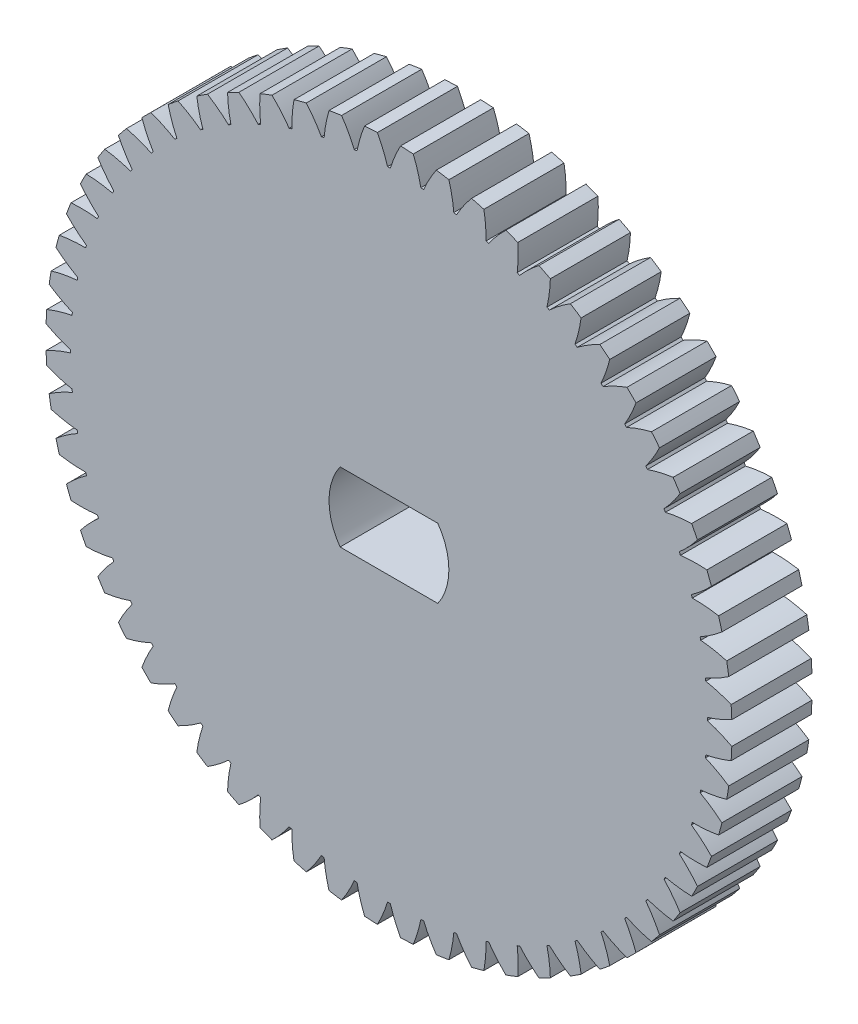
from build123d import *

# Parameters (mm, degrees)
BOSS_EXTRUDE1_DEPTH = 3.175


with BuildPart() as part:
    # Sketch2 → Boss-Extrude1 (new body)
    with BuildSketch(Plane.XY):
        with BuildLine():
            ThreePointArc((9.415507018, 8.403216731), (9.37852962, 8.444465999), (9.34137151, 8.485552554))
            ThreePointArc((9.34137151, 8.485552554), (9.588912282, 8.948159752), (9.790125097, 9.432716514))
            ThreePointArc((9.790125097, 9.432716514), (9.613081978, 9.613081978), (9.432716514, 9.790125097))
            ThreePointArc((9.432716514, 9.790125097), (8.948159752, 9.588912282), (8.485552554, 9.34137151))
            ThreePointArc((8.485552554, 9.34137151), (8.444465999, 9.37852962), (8.403216731, 9.415507018))
            ThreePointArc((8.403216731, 9.415507018), (8.601045829, 9.901455062), (8.750506405, 10.404389838))
            ThreePointArc((8.750506405, 10.404389838), (8.555579823, 10.565261196), (8.357696375, 10.722481129))
            ThreePointArc((8.357696375, 10.722481129), (7.896826531, 10.471720605), (7.4626286, 10.177180268))
            ThreePointArc((7.4626286, 10.177180268), (7.417883042, 10.209840107), (7.372994551, 10.242303217))
            ThreePointArc((7.372994551, 10.242303217), (7.518944518, 10.746267958), (7.615015335, 11.262070489))
            ThreePointArc((7.615015335, 11.262070489), (7.404340945, 11.401685201), (7.191107565, 11.537359414))
            ThreePointArc((7.191107565, 11.537359414), (6.758974027, 11.239798566), (6.357942526, 10.901485709))
            ThreePointArc((6.357942526, 10.901485709), (6.310028206, 10.92928945), (6.2619923, 10.956882598))
            ThreePointArc((6.2619923, 10.956882598), (6.354464078, 11.473342493), (6.396092562, 11.996361539))
            ThreePointArc((6.396092562, 11.996361539), (6.171978558, 12.113189957), (5.945731475, 12.225831975))
            ThreePointArc((5.945731475, 12.225831975), (5.547068788, 11.884730941), (5.183597503, 11.506352192))
            ThreePointArc((5.183597503, 11.506352192), (5.13303938, 11.52899521), (5.082382351, 11.551416081))
            ThreePointArc((5.082382351, 11.551416081), (5.120362799, 12.074712688), (5.107092862, 12.599217942))
            ThreePointArc((5.107092862, 12.599217942), (4.871994682, 12.691980069), (4.635212708, 12.780355762))
            ThreePointArc((4.635212708, 12.780355762), (4.274388703, 12.399451718), (3.952459901, 11.985152672))
            ThreePointArc((3.952459901, 11.985152672), (3.899811901, 12.002386886), (3.847088757, 12.019389832))
            ThreePointArc((3.847088757, 12.019389832), (3.830161755, 12.543789803), (3.762138783, 13.064034676))
            ThreePointArc((3.762138783, 13.064034676), (3.518632213, 13.131714191), (3.27390958, 13.194855297))
            ThreePointArc((3.27390958, 13.194855297), (2.954877521, 12.778321506), (2.678018322, 12.332641311))
            ThreePointArc((2.678018322, 12.332641311), (2.623857267, 12.3442779), (2.569645654, 12.355676633))
            ThreePointArc((2.569645654, 12.355676633), (2.497996656, 12.875434532), (2.375965924, 13.385719113))
            ThreePointArc((2.375965924, 13.385719113), (2.126718873, 13.427574505), (1.876736813, 13.464789236))
            ThreePointArc((1.876736813, 13.464789236), (1.602992083, 13.017189331), (1.374235813, 12.545010951))
            ThreePointArc((1.374235813, 12.545010951), (1.319155103, 12.550922422), (1.264048975, 12.556592055))
            ThreePointArc((1.264048975, 12.556592055), (1.138462984, 13.066013306), (0.963761486, 13.56074681))
            ThreePointArc((0.963761486, 13.56074681), (0.711504756, 13.576319502), (0.459002126, 13.587200127))
            ThreePointArc((0.459002126, 13.587200127), (0.233543928, 13.113438104), (0.055396889, 12.619934826))
            ThreePointArc((0.055396889, 12.619934826), (0, 12.620056412), (-0.055396889, 12.619934826))
            ThreePointArc((-0.055396889, 12.619934826), (-0.233543928, 13.113438104), (-0.459002126, 13.587200127))
            ThreePointArc((-0.459002126, 13.587200127), (-0.711504756, 13.576319502), (-0.963761486, 13.56074681))
            ThreePointArc((-0.963761486, 13.56074681), (-1.138462984, 13.066013306), (-1.264048975, 12.556592055))
            ThreePointArc((-1.264048975, 12.556592055), (-1.319155103, 12.550922422), (-1.374235813, 12.545010951))
            ThreePointArc((-1.374235813, 12.545010951), (-1.602992083, 13.017189331), (-1.876736813, 13.464789236))
            ThreePointArc((-1.876736813, 13.464789236), (-2.126718873, 13.427574505), (-2.375965924, 13.385719113))
            ThreePointArc((-2.375965924, 13.385719113), (-2.497996656, 12.875434532), (-2.569645654, 12.355676633))
            ThreePointArc((-2.569645654, 12.355676633), (-2.623857267, 12.3442779), (-2.678018322, 12.332641311))
            ThreePointArc((-2.678018322, 12.332641311), (-2.954877521, 12.778321506), (-3.27390958, 13.194855297))
            ThreePointArc((-3.27390958, 13.194855297), (-3.518632213, 13.131714191), (-3.762138783, 13.064034676))
            ThreePointArc((-3.762138783, 13.064034676), (-3.830161755, 12.543789803), (-3.847088757, 12.019389832))
            ThreePointArc((-3.847088757, 12.019389832), (-3.899811901, 12.002386886), (-3.952459901, 11.985152672))
            ThreePointArc((-3.952459901, 11.985152672), (-4.274388703, 12.399451718), (-4.635212708, 12.780355762))
            ThreePointArc((-4.635212708, 12.780355762), (-4.871994682, 12.691980069), (-5.107092862, 12.599217942))
            ThreePointArc((-5.107092862, 12.599217942), (-5.120362799, 12.074712688), (-5.082382351, 11.551416081))
            ThreePointArc((-5.082382351, 11.551416081), (-5.13303938, 11.52899521), (-5.183597503, 11.506352192))
            ThreePointArc((-5.183597503, 11.506352192), (-5.547068788, 11.884730941), (-5.945731475, 12.225831975))
            ThreePointArc((-5.945731475, 12.225831975), (-6.171978558, 12.113189957), (-6.396092562, 11.996361539))
            ThreePointArc((-6.396092562, 11.996361539), (-6.354464078, 11.473342493), (-6.2619923, 10.956882598))
            ThreePointArc((-6.2619923, 10.956882598), (-6.310028206, 10.92928945), (-6.357942526, 10.901485709))
            ThreePointArc((-6.357942526, 10.901485709), (-6.758974027, 11.239798566), (-7.191107565, 11.537359414))
            ThreePointArc((-7.191107565, 11.537359414), (-7.404340945, 11.401685201), (-7.615015335, 11.262070489))
            ThreePointArc((-7.615015335, 11.262070489), (-7.518944518, 10.746267958), (-7.372994551, 10.242303217))
            ThreePointArc((-7.372994551, 10.242303217), (-7.417883042, 10.209840107), (-7.4626286, 10.177180268))
            ThreePointArc((-7.4626286, 10.177180268), (-7.896826531, 10.471720605), (-8.357696375, 10.722481129))
            ThreePointArc((-8.357696375, 10.722481129), (-8.555579823, 10.565261196), (-8.750506405, 10.404389838))
            ThreePointArc((-8.750506405, 10.404389838), (-8.601045829, 9.901455062), (-8.403216731, 9.415507018))
            ThreePointArc((-8.403216731, 9.415507018), (-8.444465999, 9.37852962), (-8.485552554, 9.34137151))
            ThreePointArc((-8.485552554, 9.34137151), (-8.948159752, 9.588912282), (-9.432716514, 9.790125097))
            ThreePointArc((-9.432716514, 9.790125097), (-9.613081978, 9.613081978), (-9.790125097, 9.432716514))
            ThreePointArc((-9.790125097, 9.432716514), (-9.588912282, 8.948159752), (-9.34137151, 8.485552554))
            ThreePointArc((-9.34137151, 8.485552554), (-9.37852962, 8.444465999), (-9.415507018, 8.403216731))
            ThreePointArc((-9.415507018, 8.403216731), (-9.901455062, 8.601045829), (-10.404389838, 8.750506405))
            ThreePointArc((-10.404389838, 8.750506405), (-10.565261196, 8.555579823), (-10.722481129, 8.357696375))
            ThreePointArc((-10.722481129, 8.357696375), (-10.471720605, 7.896826531), (-10.177180268, 7.4626286))
            ThreePointArc((-10.177180268, 7.4626286), (-10.209840107, 7.417883042), (-10.242303217, 7.372994551))
            ThreePointArc((-10.242303217, 7.372994551), (-10.746267958, 7.518944518), (-11.262070489, 7.615015335))
            ThreePointArc((-11.262070489, 7.615015335), (-11.401685201, 7.404340945), (-11.537359414, 7.191107565))
            ThreePointArc((-11.537359414, 7.191107565), (-11.239798566, 6.758974027), (-10.901485709, 6.357942526))
            ThreePointArc((-10.901485709, 6.357942526), (-10.92928945, 6.310028206), (-10.956882598, 6.2619923))
            ThreePointArc((-10.956882598, 6.2619923), (-11.473342493, 6.354464078), (-11.996361539, 6.396092562))
            ThreePointArc((-11.996361539, 6.396092562), (-12.113189957, 6.171978558), (-12.225831975, 5.945731475))
            ThreePointArc((-12.225831975, 5.945731475), (-11.884730941, 5.547068788), (-11.506352192, 5.183597503))
            ThreePointArc((-11.506352192, 5.183597503), (-11.52899521, 5.13303938), (-11.551416081, 5.082382351))
            ThreePointArc((-11.551416081, 5.082382351), (-12.074712688, 5.120362799), (-12.599217942, 5.107092862))
            ThreePointArc((-12.599217942, 5.107092862), (-12.691980069, 4.871994682), (-12.780355762, 4.635212708))
            ThreePointArc((-12.780355762, 4.635212708), (-12.399451718, 4.274388703), (-11.985152672, 3.952459901))
            ThreePointArc((-11.985152672, 3.952459901), (-12.002386886, 3.899811901), (-12.019389832, 3.847088757))
            ThreePointArc((-12.019389832, 3.847088757), (-12.543789803, 3.830161755), (-13.064034676, 3.762138783))
            ThreePointArc((-13.064034676, 3.762138783), (-13.131714191, 3.518632213), (-13.194855297, 3.27390958))
            ThreePointArc((-13.194855297, 3.27390958), (-12.778321506, 2.954877521), (-12.332641311, 2.678018322))
            ThreePointArc((-12.332641311, 2.678018322), (-12.3442779, 2.623857267), (-12.355676633, 2.569645654))
            ThreePointArc((-12.355676633, 2.569645654), (-12.875434532, 2.497996656), (-13.385719113, 2.375965924))
            ThreePointArc((-13.385719113, 2.375965924), (-13.427574505, 2.126718873), (-13.464789236, 1.876736813))
            ThreePointArc((-13.464789236, 1.876736813), (-13.017189331, 1.602992083), (-12.545010951, 1.374235813))
            ThreePointArc((-12.545010951, 1.374235813), (-12.550922422, 1.319155103), (-12.556592055, 1.264048975))
            ThreePointArc((-12.556592055, 1.264048975), (-13.066013306, 1.138462984), (-13.56074681, 0.963761486))
            ThreePointArc((-13.56074681, 0.963761486), (-13.576319502, 0.711504756), (-13.587200127, 0.459002126))
            ThreePointArc((-13.587200127, 0.459002126), (-13.113438104, 0.233543928), (-12.619934826, 0.055396889))
            ThreePointArc((-12.619934826, 0.055396889), (-12.620056412, 0), (-12.619934826, -0.055396889))
            ThreePointArc((-12.619934826, -0.055396889), (-13.113438104, -0.233543928), (-13.587200127, -0.459002126))
            ThreePointArc((-13.587200127, -0.459002126), (-13.576319502, -0.711504756), (-13.56074681, -0.963761486))
            ThreePointArc((-13.56074681, -0.963761486), (-13.066013306, -1.138462984), (-12.556592055, -1.264048975))
            ThreePointArc((-12.556592055, -1.264048975), (-12.550922422, -1.319155103), (-12.545010951, -1.374235813))
            ThreePointArc((-12.545010951, -1.374235813), (-13.017189331, -1.602992083), (-13.464789236, -1.876736813))
            ThreePointArc((-13.464789236, -1.876736813), (-13.427574505, -2.126718873), (-13.385719113, -2.375965924))
            ThreePointArc((-13.385719113, -2.375965924), (-12.875434532, -2.497996656), (-12.355676633, -2.569645654))
            ThreePointArc((-12.355676633, -2.569645654), (-12.3442779, -2.623857267), (-12.332641311, -2.678018322))
            ThreePointArc((-12.332641311, -2.678018322), (-12.778321506, -2.954877521), (-13.194855297, -3.27390958))
            ThreePointArc((-13.194855297, -3.27390958), (-13.131714191, -3.518632213), (-13.064034676, -3.762138783))
            ThreePointArc((-13.064034676, -3.762138783), (-12.543789803, -3.830161755), (-12.019389832, -3.847088757))
            ThreePointArc((-12.019389832, -3.847088757), (-12.002386886, -3.899811901), (-11.985152672, -3.952459901))
            ThreePointArc((-11.985152672, -3.952459901), (-12.399451718, -4.274388703), (-12.780355762, -4.635212708))
            ThreePointArc((-12.780355762, -4.635212708), (-12.691980069, -4.871994682), (-12.599217942, -5.107092862))
            ThreePointArc((-12.599217942, -5.107092862), (-12.074712688, -5.120362799), (-11.551416081, -5.082382351))
            ThreePointArc((-11.551416081, -5.082382351), (-11.52899521, -5.13303938), (-11.506352192, -5.183597503))
            ThreePointArc((-11.506352192, -5.183597503), (-11.884730941, -5.547068788), (-12.225831975, -5.945731475))
            ThreePointArc((-12.225831975, -5.945731475), (-12.113189957, -6.171978558), (-11.996361539, -6.396092562))
            ThreePointArc((-11.996361539, -6.396092562), (-11.473342493, -6.354464078), (-10.956882598, -6.2619923))
            ThreePointArc((-10.956882598, -6.2619923), (-10.92928945, -6.310028206), (-10.901485709, -6.357942526))
            ThreePointArc((-10.901485709, -6.357942526), (-11.239798566, -6.758974027), (-11.537359414, -7.191107565))
            ThreePointArc((-11.537359414, -7.191107565), (-11.401685201, -7.404340945), (-11.262070489, -7.615015335))
            ThreePointArc((-11.262070489, -7.615015335), (-10.746267958, -7.518944518), (-10.242303217, -7.372994551))
            ThreePointArc((-10.242303217, -7.372994551), (-10.209840107, -7.417883042), (-10.177180268, -7.4626286))
            ThreePointArc((-10.177180268, -7.4626286), (-10.471720605, -7.896826531), (-10.722481129, -8.357696375))
            ThreePointArc((-10.722481129, -8.357696375), (-10.565261196, -8.555579823), (-10.404389838, -8.750506405))
            ThreePointArc((-10.404389838, -8.750506405), (-9.901455062, -8.601045829), (-9.415507018, -8.403216731))
            ThreePointArc((-9.415507018, -8.403216731), (-9.37852962, -8.444465999), (-9.34137151, -8.485552554))
            ThreePointArc((-9.34137151, -8.485552554), (-9.588912282, -8.948159752), (-9.790125097, -9.432716514))
            ThreePointArc((-9.790125097, -9.432716514), (-9.613081978, -9.613081978), (-9.432716514, -9.790125097))
            ThreePointArc((-9.432716514, -9.790125097), (-8.948159752, -9.588912282), (-8.485552554, -9.34137151))
            ThreePointArc((-8.485552554, -9.34137151), (-8.444465999, -9.37852962), (-8.403216731, -9.415507018))
            ThreePointArc((-8.403216731, -9.415507018), (-8.601045829, -9.901455062), (-8.750506405, -10.404389838))
            ThreePointArc((-8.750506405, -10.404389838), (-8.555579823, -10.565261196), (-8.357696375, -10.722481129))
            ThreePointArc((-8.357696375, -10.722481129), (-7.896826531, -10.471720605), (-7.4626286, -10.177180268))
            ThreePointArc((-7.4626286, -10.177180268), (-7.417883042, -10.209840107), (-7.372994551, -10.242303217))
            ThreePointArc((-7.372994551, -10.242303217), (-7.518944518, -10.746267958), (-7.615015335, -11.262070489))
            ThreePointArc((-7.615015335, -11.262070489), (-7.404340945, -11.401685201), (-7.191107565, -11.537359414))
            ThreePointArc((-7.191107565, -11.537359414), (-6.758974027, -11.239798566), (-6.357942526, -10.901485709))
            ThreePointArc((-6.357942526, -10.901485709), (-6.310028206, -10.92928945), (-6.2619923, -10.956882598))
            ThreePointArc((-6.2619923, -10.956882598), (-6.354464078, -11.473342493), (-6.396092562, -11.996361539))
            ThreePointArc((-6.396092562, -11.996361539), (-6.171978558, -12.113189957), (-5.945731475, -12.225831975))
            ThreePointArc((-5.945731475, -12.225831975), (-5.547068788, -11.884730941), (-5.183597503, -11.506352192))
            ThreePointArc((-5.183597503, -11.506352192), (-5.13303938, -11.52899521), (-5.082382351, -11.551416081))
            ThreePointArc((-5.082382351, -11.551416081), (-5.120362799, -12.074712688), (-5.107092862, -12.599217942))
            ThreePointArc((-5.107092862, -12.599217942), (-4.871994682, -12.691980069), (-4.635212708, -12.780355762))
            ThreePointArc((-4.635212708, -12.780355762), (-4.274388703, -12.399451718), (-3.952459901, -11.985152672))
            ThreePointArc((-3.952459901, -11.985152672), (-3.899811901, -12.002386886), (-3.847088757, -12.019389832))
            ThreePointArc((-3.847088757, -12.019389832), (-3.830161755, -12.543789803), (-3.762138783, -13.064034676))
            ThreePointArc((-3.762138783, -13.064034676), (-3.518632213, -13.131714191), (-3.27390958, -13.194855297))
            ThreePointArc((-3.27390958, -13.194855297), (-2.954877521, -12.778321506), (-2.678018322, -12.332641311))
            ThreePointArc((-2.678018322, -12.332641311), (-2.623857267, -12.3442779), (-2.569645654, -12.355676633))
            ThreePointArc((-2.569645654, -12.355676633), (-2.497996656, -12.875434532), (-2.375965924, -13.385719113))
            ThreePointArc((-2.375965924, -13.385719113), (-2.126718873, -13.427574505), (-1.876736813, -13.464789236))
            ThreePointArc((-1.876736813, -13.464789236), (-1.602992083, -13.017189331), (-1.374235813, -12.545010951))
            ThreePointArc((-1.374235813, -12.545010951), (-1.319155103, -12.550922422), (-1.264048975, -12.556592055))
            ThreePointArc((-1.264048975, -12.556592055), (-1.138462984, -13.066013306), (-0.963761486, -13.56074681))
            ThreePointArc((-0.963761486, -13.56074681), (-0.711504756, -13.576319502), (-0.459002126, -13.587200127))
            ThreePointArc((-0.459002126, -13.587200127), (-0.233543928, -13.113438104), (-0.055396889, -12.619934826))
            ThreePointArc((-0.055396889, -12.619934826), (0, -12.620056412), (0.055396889, -12.619934826))
            ThreePointArc((0.055396889, -12.619934826), (0.233543928, -13.113438104), (0.459002126, -13.587200127))
            ThreePointArc((0.459002126, -13.587200127), (0.711504756, -13.576319502), (0.963761486, -13.56074681))
            ThreePointArc((0.963761486, -13.56074681), (1.138462984, -13.066013306), (1.264048975, -12.556592055))
            ThreePointArc((1.264048975, -12.556592055), (1.319155103, -12.550922422), (1.374235813, -12.545010951))
            ThreePointArc((1.374235813, -12.545010951), (1.602992083, -13.017189331), (1.876736813, -13.464789236))
            ThreePointArc((1.876736813, -13.464789236), (2.126718873, -13.427574505), (2.375965924, -13.385719113))
            ThreePointArc((2.375965924, -13.385719113), (2.497996656, -12.875434532), (2.569645654, -12.355676633))
            ThreePointArc((2.569645654, -12.355676633), (2.623857267, -12.3442779), (2.678018322, -12.332641311))
            ThreePointArc((2.678018322, -12.332641311), (2.954877521, -12.778321506), (3.27390958, -13.194855297))
            ThreePointArc((3.27390958, -13.194855297), (3.518632213, -13.131714191), (3.762138783, -13.064034676))
            ThreePointArc((3.762138783, -13.064034676), (3.830161755, -12.543789803), (3.847088757, -12.019389832))
            ThreePointArc((3.847088757, -12.019389832), (3.899811901, -12.002386886), (3.952459901, -11.985152672))
            ThreePointArc((3.952459901, -11.985152672), (4.274388703, -12.399451718), (4.635212708, -12.780355762))
            ThreePointArc((4.635212708, -12.780355762), (4.871994682, -12.691980069), (5.107092862, -12.599217942))
            ThreePointArc((5.107092862, -12.599217942), (5.120362799, -12.074712688), (5.082382351, -11.551416081))
            ThreePointArc((5.082382351, -11.551416081), (5.13303938, -11.52899521), (5.183597503, -11.506352192))
            ThreePointArc((5.183597503, -11.506352192), (5.547068788, -11.884730941), (5.945731475, -12.225831975))
            ThreePointArc((5.945731475, -12.225831975), (6.171978558, -12.113189957), (6.396092562, -11.996361539))
            ThreePointArc((6.396092562, -11.996361539), (6.354464078, -11.473342493), (6.2619923, -10.956882598))
            ThreePointArc((6.2619923, -10.956882598), (6.310028206, -10.92928945), (6.357942526, -10.901485709))
            ThreePointArc((6.357942526, -10.901485709), (6.758974027, -11.239798566), (7.191107565, -11.537359414))
            ThreePointArc((7.191107565, -11.537359414), (7.404340945, -11.401685201), (7.615015335, -11.262070489))
            ThreePointArc((7.615015335, -11.262070489), (7.518944518, -10.746267958), (7.372994551, -10.242303217))
            ThreePointArc((7.372994551, -10.242303217), (7.417883042, -10.209840107), (7.4626286, -10.177180268))
            ThreePointArc((7.4626286, -10.177180268), (7.896826531, -10.471720605), (8.357696375, -10.722481129))
            ThreePointArc((8.357696375, -10.722481129), (8.555579823, -10.565261196), (8.750506405, -10.404389838))
            ThreePointArc((8.750506405, -10.404389838), (8.601045829, -9.901455062), (8.403216731, -9.415507018))
            ThreePointArc((8.403216731, -9.415507018), (8.444465999, -9.37852962), (8.485552554, -9.34137151))
            ThreePointArc((8.485552554, -9.34137151), (8.948159752, -9.588912282), (9.432716514, -9.790125097))
            ThreePointArc((9.432716514, -9.790125097), (9.613081978, -9.613081978), (9.790125097, -9.432716514))
            ThreePointArc((9.790125097, -9.432716514), (9.588912282, -8.948159752), (9.34137151, -8.485552554))
            ThreePointArc((9.34137151, -8.485552554), (9.37852962, -8.444465999), (9.415507018, -8.403216731))
            ThreePointArc((9.415507018, -8.403216731), (9.901455062, -8.601045829), (10.404389838, -8.750506405))
            ThreePointArc((10.404389838, -8.750506405), (10.565261196, -8.555579823), (10.722481129, -8.357696375))
            ThreePointArc((10.722481129, -8.357696375), (10.471720605, -7.896826531), (10.177180268, -7.4626286))
            ThreePointArc((10.177180268, -7.4626286), (10.209840107, -7.417883042), (10.242303217, -7.372994551))
            ThreePointArc((10.242303217, -7.372994551), (10.746267958, -7.518944518), (11.262070489, -7.615015335))
            ThreePointArc((11.262070489, -7.615015335), (11.401685201, -7.404340945), (11.537359414, -7.191107565))
            ThreePointArc((11.537359414, -7.191107565), (11.239798566, -6.758974027), (10.901485709, -6.357942526))
            ThreePointArc((10.901485709, -6.357942526), (10.92928945, -6.310028206), (10.956882598, -6.2619923))
            ThreePointArc((10.956882598, -6.2619923), (11.473342493, -6.354464078), (11.996361539, -6.396092562))
            ThreePointArc((11.996361539, -6.396092562), (12.113189957, -6.171978558), (12.225831975, -5.945731475))
            ThreePointArc((12.225831975, -5.945731475), (11.884730941, -5.547068788), (11.506352192, -5.183597503))
            ThreePointArc((11.506352192, -5.183597503), (11.52899521, -5.13303938), (11.551416081, -5.082382351))
            ThreePointArc((11.551416081, -5.082382351), (12.074712688, -5.120362799), (12.599217942, -5.107092862))
            ThreePointArc((12.599217942, -5.107092862), (12.691980069, -4.871994682), (12.780355762, -4.635212708))
            ThreePointArc((12.780355762, -4.635212708), (12.399451718, -4.274388703), (11.985152672, -3.952459901))
            ThreePointArc((11.985152672, -3.952459901), (12.002386886, -3.899811901), (12.019389832, -3.847088757))
            ThreePointArc((12.019389832, -3.847088757), (12.543789803, -3.830161755), (13.064034676, -3.762138783))
            ThreePointArc((13.064034676, -3.762138783), (13.131714191, -3.518632213), (13.194855297, -3.27390958))
            ThreePointArc((13.194855297, -3.27390958), (12.778321506, -2.954877521), (12.332641311, -2.678018322))
            ThreePointArc((12.332641311, -2.678018322), (12.3442779, -2.623857267), (12.355676633, -2.569645654))
            ThreePointArc((12.355676633, -2.569645654), (12.875434532, -2.497996656), (13.385719113, -2.375965924))
            ThreePointArc((13.385719113, -2.375965924), (13.427574505, -2.126718873), (13.464789236, -1.876736813))
            ThreePointArc((13.464789236, -1.876736813), (13.017189331, -1.602992083), (12.545010951, -1.374235813))
            ThreePointArc((12.545010951, -1.374235813), (12.550922422, -1.319155103), (12.556592055, -1.264048975))
            ThreePointArc((12.556592055, -1.264048975), (13.066013306, -1.138462984), (13.56074681, -0.963761486))
            ThreePointArc((13.56074681, -0.963761486), (13.576319502, -0.711504756), (13.587200127, -0.459002126))
            ThreePointArc((13.587200127, -0.459002126), (13.113438104, -0.233543928), (12.619934826, -0.055396889))
            ThreePointArc((12.619934826, -0.055396889), (12.620056412, 0), (12.619934826, 0.055396889))
            ThreePointArc((12.619934826, 0.055396889), (13.113438104, 0.233543928), (13.587200127, 0.459002126))
            ThreePointArc((13.587200127, 0.459002126), (13.576319502, 0.711504756), (13.56074681, 0.963761486))
            ThreePointArc((13.56074681, 0.963761486), (13.066013306, 1.138462984), (12.556592055, 1.264048975))
            ThreePointArc((12.556592055, 1.264048975), (12.550922422, 1.319155103), (12.545010951, 1.374235813))
            ThreePointArc((12.545010951, 1.374235813), (13.017189331, 1.602992083), (13.464789236, 1.876736813))
            ThreePointArc((13.464789236, 1.876736813), (13.427574505, 2.126718873), (13.385719113, 2.375965924))
            ThreePointArc((13.385719113, 2.375965924), (12.875434532, 2.497996656), (12.355676633, 2.569645654))
            ThreePointArc((12.355676633, 2.569645654), (12.3442779, 2.623857267), (12.332641311, 2.678018322))
            ThreePointArc((12.332641311, 2.678018322), (12.778321506, 2.954877521), (13.194855297, 3.27390958))
            ThreePointArc((13.194855297, 3.27390958), (13.131714191, 3.518632213), (13.064034676, 3.762138783))
            ThreePointArc((13.064034676, 3.762138783), (12.543789803, 3.830161755), (12.019389832, 3.847088757))
            ThreePointArc((12.019389832, 3.847088757), (12.002386886, 3.899811901), (11.985152672, 3.952459901))
            ThreePointArc((11.985152672, 3.952459901), (12.399451718, 4.274388703), (12.780355762, 4.635212708))
            ThreePointArc((12.780355762, 4.635212708), (12.691980069, 4.871994682), (12.599217942, 5.107092862))
            ThreePointArc((12.599217942, 5.107092862), (12.074712688, 5.120362799), (11.551416081, 5.082382351))
            ThreePointArc((11.551416081, 5.082382351), (11.52899521, 5.13303938), (11.506352192, 5.183597503))
            ThreePointArc((11.506352192, 5.183597503), (11.884730941, 5.547068788), (12.225831975, 5.945731475))
            ThreePointArc((12.225831975, 5.945731475), (12.113189957, 6.171978558), (11.996361539, 6.396092562))
            ThreePointArc((11.996361539, 6.396092562), (11.473342493, 6.354464078), (10.956882598, 6.2619923))
            ThreePointArc((10.956882598, 6.2619923), (10.92928945, 6.310028206), (10.901485709, 6.357942526))
            ThreePointArc((10.901485709, 6.357942526), (11.239798566, 6.758974027), (11.537359414, 7.191107565))
            ThreePointArc((11.537359414, 7.191107565), (11.401685201, 7.404340945), (11.262070489, 7.615015335))
            ThreePointArc((11.262070489, 7.615015335), (10.746267958, 7.518944518), (10.242303217, 7.372994551))
            ThreePointArc((10.242303217, 7.372994551), (10.209840107, 7.417883042), (10.177180268, 7.4626286))
            ThreePointArc((10.177180268, 7.4626286), (10.471720605, 7.896826531), (10.722481129, 8.357696375))
            ThreePointArc((10.722481129, 8.357696375), (10.565261196, 8.555579823), (10.404389838, 8.750506405))
            ThreePointArc((10.404389838, 8.750506405), (9.901455062, 8.601045829), (9.415507018, 8.403216731))
        make_face()
        with BuildLine():
            Line((-1.936491673, 1.375), (1.936491673, 1.375))
            ThreePointArc((1.936491673, 1.375), (2.375, 0), (1.936491673, -1.375))
            Line((1.936491673, -1.375), (-1.936491673, -1.375))
            ThreePointArc((-1.936491673, -1.375), (-2.375, 0), (-1.936491673, 1.375))
        make_face(mode=Mode.SUBTRACT)
    extrude(amount=BOSS_EXTRUDE1_DEPTH)


solid = part.part
